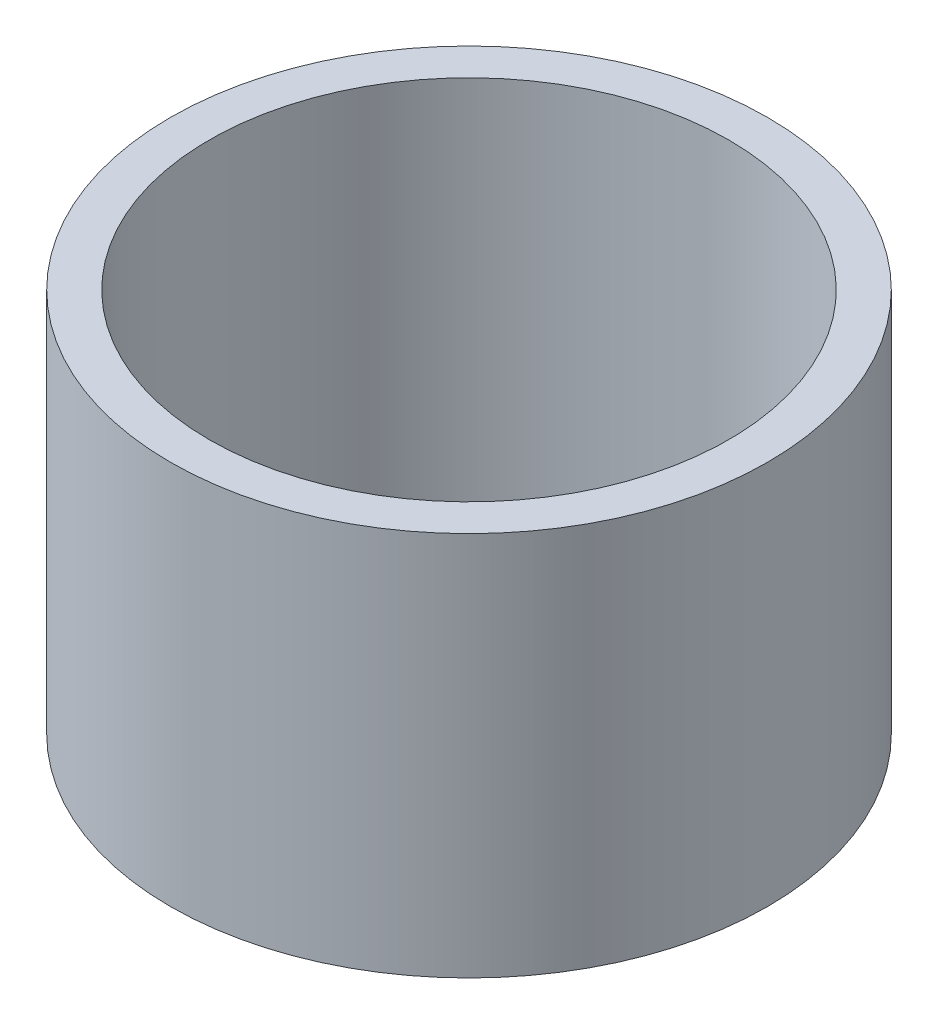
from build123d import *

# Parameters (mm, degrees)
SKETCH1_R           = 37.94599
BOSS_EXTRUDE1_DEPTH = 48.9
SKETCH2_R           = 33
CUT_EXTRUDE1_DEPTH  = 46.9
SKETCH3_R           = 3.925
BOSS_EXTRUDE2_DEPTH = 10


with BuildPart() as part:
    # Sketch1 → Boss-Extrude1 (new body)
    with BuildSketch(Plane(origin=(0, 0, 0), x_dir=(1, 0, 0), z_dir=(0, 1, 0))):
        Circle(SKETCH1_R)
    extrude(amount=BOSS_EXTRUDE1_DEPTH)

    # Sketch2 → Cut-Extrude1 (cut)
    with BuildSketch(Plane(origin=(0, 48.9, 0), x_dir=(1, 0, 0), z_dir=(0, 1, 0))):
        Circle(SKETCH2_R)
    extrude(amount=-CUT_EXTRUDE1_DEPTH, mode=Mode.SUBTRACT)

    # Sketch3 → Boss-Extrude2 (add)
    with BuildSketch(Plane.XZ):
        Circle(SKETCH3_R)
    extrude(amount=BOSS_EXTRUDE2_DEPTH)


solid = part.part
